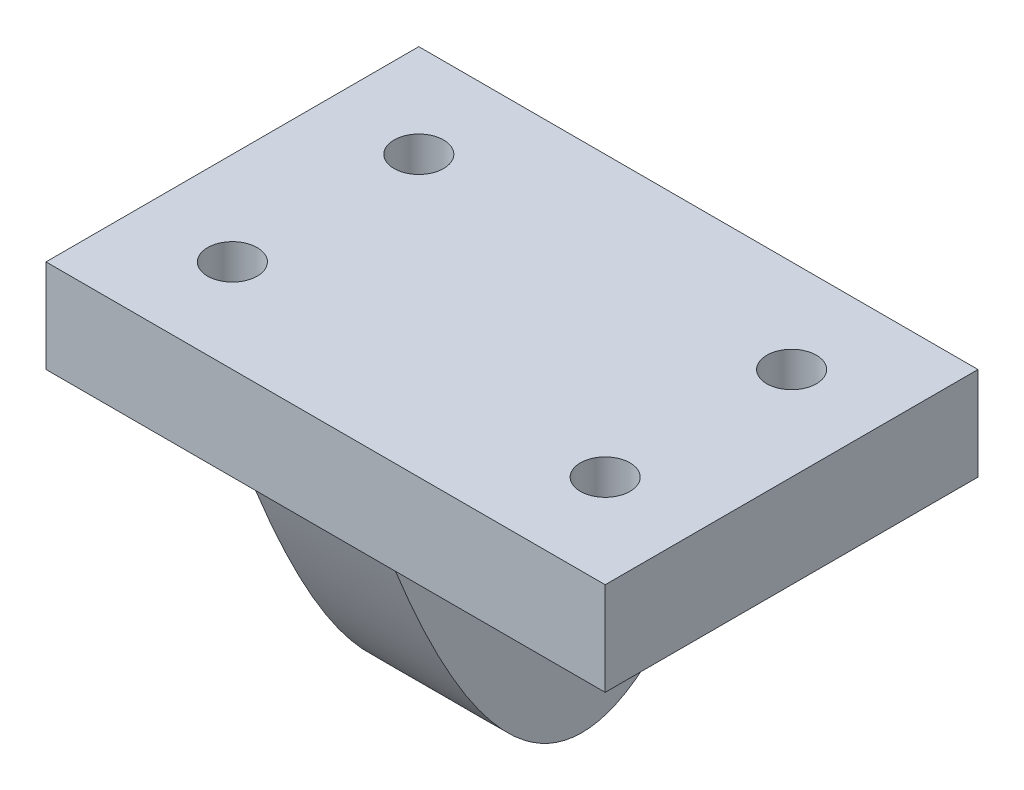
from build123d import *

# Parameters (mm, degrees)
SKETCH1_W           = 76.2
SKETCH1_H           = 50.8
SKETCH1_R           = 3.3782
BOSS_EXTRUDE1_DEPTH = 12.7
SKETCH1_3_W         = 19.05
SKETCH1_3_H         = 50.8
BOSS_EXTRUDE2_DEPTH = 44.45
SKETCH2_R           = 3.3782
CUT_EXTRUDE1_DEPTH  = 70.922121857


with BuildPart() as part:
    # Sketch1 → Boss-Extrude1 (new body)
    with BuildSketch(Plane(origin=(0, 0, 0), x_dir=(1, 0, 0), z_dir=(0, 1, 0))):
        Rectangle(SKETCH1_W, SKETCH1_H)
        with Locations((-25.4, -12.7)):
            Circle(SKETCH1_R, mode=Mode.SUBTRACT)
        with Locations((-25.4, 12.7)):
            Circle(SKETCH1_R, mode=Mode.SUBTRACT)
        with Locations((25.4, 12.7)):
            Circle(SKETCH1_R, mode=Mode.SUBTRACT)
        with Locations((25.4, -12.7)):
            Circle(SKETCH1_R, mode=Mode.SUBTRACT)
    extrude(amount=BOSS_EXTRUDE1_DEPTH)

    # Sketch1<3> → Boss-Extrude2 (add)
    with BuildSketch(Plane(origin=(0, 0, 0), x_dir=(1, 0, 0), z_dir=(0, 1, 0))):
        Rectangle(SKETCH1_3_W, SKETCH1_3_H)
    extrude(amount=-BOSS_EXTRUDE2_DEPTH)

    # Sketch2 → Cut-Extrude1 (cut, through all)
    with BuildSketch(Plane.ZY.offset(9.525)):
        with Locations((0, -19.05)):
            Circle(SKETCH2_R)
        with BuildLine():
            add(Edge.make_bspline(
                [(25.4, 0), (0, -63.5), (-25.4, 0)],
                knots=[0.5, 0.5, 0.5, 1.5, 1.5, 1.5], degree=2))
            Line((-25.4, 0), (-25.4, -44.45))
            Line((-25.4, -44.45), (25.4, -44.45))
            Line((25.4, -44.45), (25.4, 0))
        make_face()
    extrude(amount=-CUT_EXTRUDE1_DEPTH, mode=Mode.SUBTRACT)


solid = part.part
